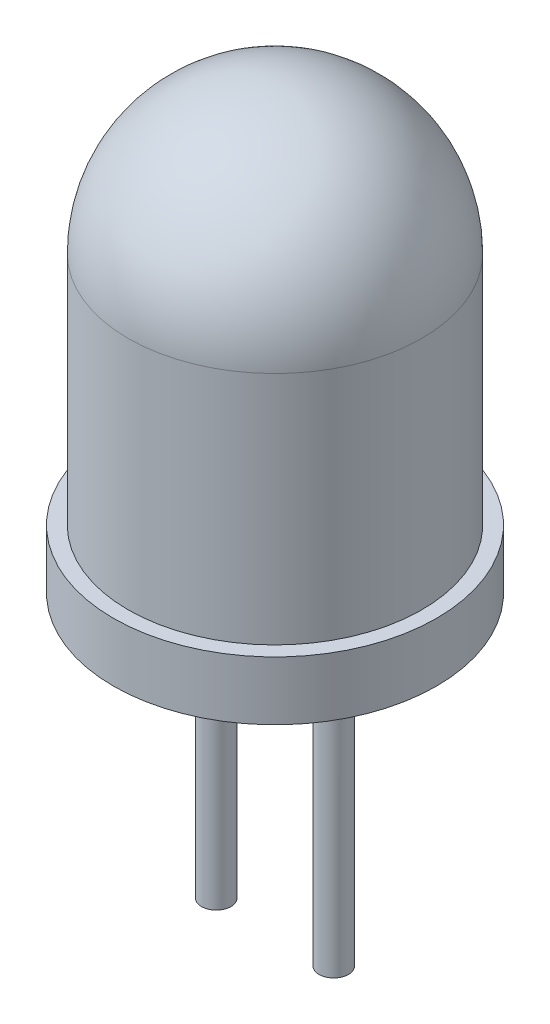
from build123d import *

# Parameters (mm, degrees)
SKETCH1_R           = 5.5
BOSS_EXTRUDE1_DEPTH = 2
SKETCH2_R           = 5
BOSS_EXTRUDE2_DEPTH = 8
SKETCH4_R           = 0.5
BOSS_EXTRUDE3_DEPTH = 10


# Read off the part's stored shape, not the designer's step: Dome1
with BuildPart() as part:
    # Sketch1 → Boss-Extrude1 (new body)
    with BuildSketch(Plane(origin=(0, 0, 0), x_dir=(1, 0, 0), z_dir=(0, 1, 0))):
        with Locations(Location((0, 0, 0), (0, 0, 270))):
            Circle(SKETCH1_R)
    extrude(amount=BOSS_EXTRUDE1_DEPTH)

    # Sketch2 → Boss-Extrude2 (add)
    with BuildSketch(Plane(origin=(0, 2, 0), x_dir=(1, 0, 0), z_dir=(0, 1, 0))):
        with Locations(Location((0, 0, 0), (0, 0, 270))):
            Circle(SKETCH2_R)
    extrude(amount=BOSS_EXTRUDE2_DEPTH)

    # Dome1 outline → Dome1 (revolve)
    with BuildSketch(Plane.XY):
        with BuildLine():
            Line((0, 10), (5, 9.999999995))
            ThreePointArc((5, 9.999999995), (3.535533908, 13.535533904), (0, 15))
            Line((0, 15), (0, 10))
        make_face()
    revolve(axis=Axis((0, 0, 0), (0, 1, 0)))

    # Sketch4 → Boss-Extrude3 (add)
    with BuildSketch(Plane.XZ):
        with Locations(Location((-2, 0, 0), (0, 0, 90))):
            Circle(SKETCH4_R)
        with Locations(Location((2, 0, 0), (0, 0, 90))):
            Circle(SKETCH4_R)
    extrude(amount=BOSS_EXTRUDE3_DEPTH)


solid = part.part
